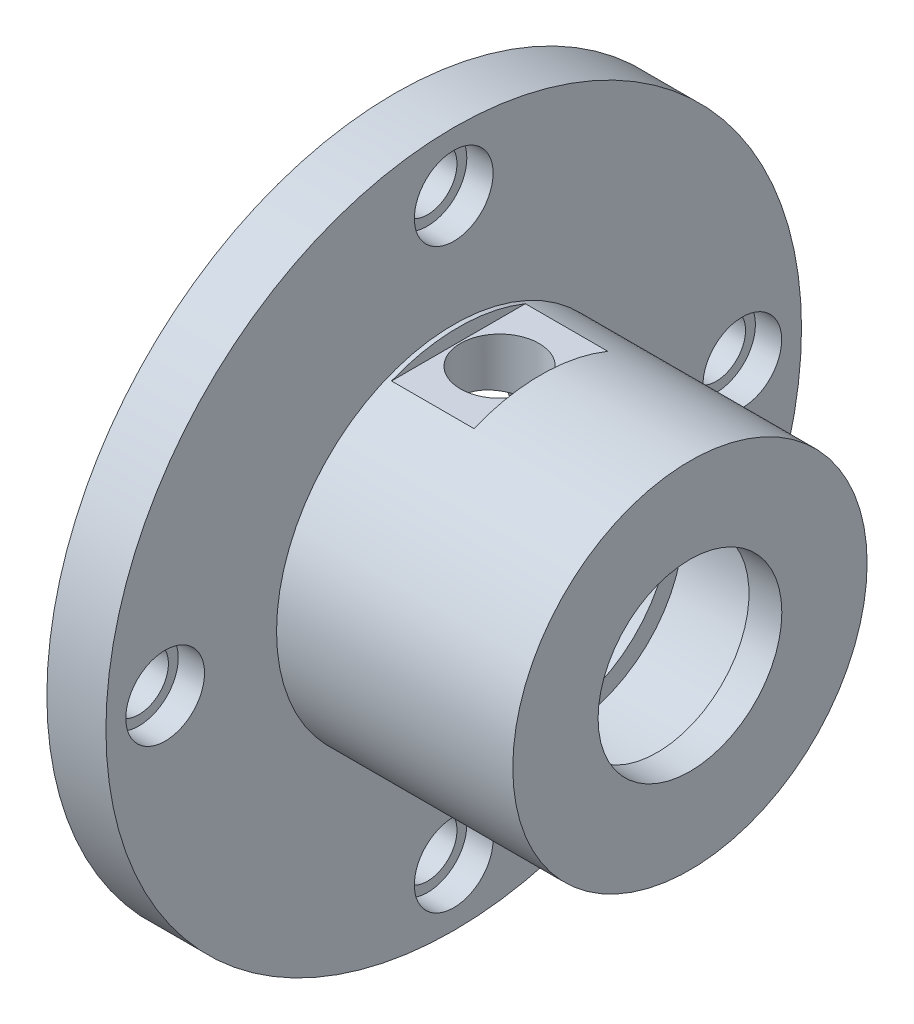
from build123d import *

# Parameters (mm, degrees)
SKETCH1_R           = 26.5
SKETCH1_R_2         = 2.25
BOSS_EXTRUDE1_DEPTH = 11.25
CUT_EXTRUDE1_START  = -18
SKETCH2_R           = 26.5
SKETCH2_R_2         = 2.25
SKETCH2_R_3         = 13.5
CUT_EXTRUDE1_DEPTH  = 18
SKETCH3_R           = 9
CUT_EXTRUDE2_DEPTH  = 20
SKETCH4_R           = 7
CUT_EXTRUDE3_DEPTH  = 20
SKETCH5_R           = 11
CUT_EXTRUDE4_DEPTH  = 0.5
SKETCH6_R           = 3
CUT_EXTRUDE5_DEPTH  = 33
SKETCH8_W           = 6.282269922
SKETCH8_H           = 12
CUT_EXTRUDE6_DEPTH  = 1
SKETCH9_R           = 3
CUT_EXTRUDE7_DEPTH  = 2


with BuildPart() as part:
    # Sketch1 → Boss-Extrude1 (new, symmetric)
    with BuildSketch(Plane(origin=(0, 0, 0), x_dir=(0, 0, -1), z_dir=(1, 0, 0))):
        Circle(SKETCH1_R)
        with Locations((0, -21.987670406)):
            Circle(SKETCH1_R_2, mode=Mode.SUBTRACT)
        with Locations((-21.987670406, 0)):
            Circle(SKETCH1_R_2, mode=Mode.SUBTRACT)
        with Locations((0, 21.987670406)):
            Circle(SKETCH1_R_2, mode=Mode.SUBTRACT)
        with Locations((21.987670406, 0)):
            Circle(SKETCH1_R_2, mode=Mode.SUBTRACT)
    extrude(amount=BOSS_EXTRUDE1_DEPTH, both=True)

    # Sketch2 → Cut-Extrude1 (cut)
    with BuildSketch(Plane(origin=(11.25, 0, 0), x_dir=(0, 0, -1), z_dir=(1, 0, 0)).offset(CUT_EXTRUDE1_START)):
        Circle(SKETCH2_R)
        with Locations((0, -21.987670406)):
            Circle(SKETCH2_R_2, mode=Mode.SUBTRACT)
        with Locations((-21.987670406, 0)):
            Circle(SKETCH2_R_2, mode=Mode.SUBTRACT)
        with Locations((0, 21.987670406)):
            Circle(SKETCH2_R_2, mode=Mode.SUBTRACT)
        Circle(SKETCH2_R_3, mode=Mode.SUBTRACT)
        with Locations((21.987670406, 0)):
            Circle(SKETCH2_R_2, mode=Mode.SUBTRACT)
    extrude(amount=CUT_EXTRUDE1_DEPTH, mode=Mode.SUBTRACT)

    # Sketch3 → Cut-Extrude2 (cut)
    with BuildSketch(Plane.ZY.offset(11.25)):
        Circle(SKETCH3_R)
    extrude(amount=-CUT_EXTRUDE2_DEPTH, mode=Mode.SUBTRACT)

    # Sketch4 → Cut-Extrude3 (cut)
    with BuildSketch(Plane.ZY.offset(-8.75)):
        Circle(SKETCH4_R)
    extrude(amount=-CUT_EXTRUDE3_DEPTH, mode=Mode.SUBTRACT)

    # Sketch5 → Cut-Extrude4 (cut, symmetric)
    with BuildSketch(Plane.ZY.offset(-1.25)):
        Circle(SKETCH5_R)
    extrude(amount=CUT_EXTRUDE4_DEPTH, both=True, mode=Mode.SUBTRACT)

    # Sketch6 → Cut-Extrude5 (cut)
    with BuildSketch(Plane(origin=(0, 0, 0), x_dir=(1, 0, 0), z_dir=(0, 1, 0))):
        with Locations((-3.25, 0)):
            Circle(SKETCH6_R)
    extrude(amount=CUT_EXTRUDE5_DEPTH, mode=Mode.SUBTRACT)

    # Sketch8 → Cut-Extrude6 (cut)
    with BuildSketch(Plane(origin=(0, 13.5, 0), x_dir=(1, 0, 0), z_dir=(0, 1, 0))):
        with Locations((-3.25, 0)):
            Rectangle(SKETCH8_W, SKETCH8_H)
    extrude(amount=-CUT_EXTRUDE6_DEPTH, mode=Mode.SUBTRACT)

    # Sketch9 → Cut-Extrude7 (cut)
    with BuildSketch(Plane(origin=(-6.75, 0, 0), x_dir=(0, 0, -1), z_dir=(1, 0, 0))):
        with Locations((0, 21.987670406)):
            Circle(SKETCH9_R)
        with Locations((21.987670406, 0)):
            Circle(SKETCH9_R)
        with Locations((0, -21.987670406)):
            Circle(SKETCH9_R)
        with Locations((-21.987670406, 0)):
            Circle(SKETCH9_R)
    extrude(amount=-CUT_EXTRUDE7_DEPTH, mode=Mode.SUBTRACT)


solid = part.part
